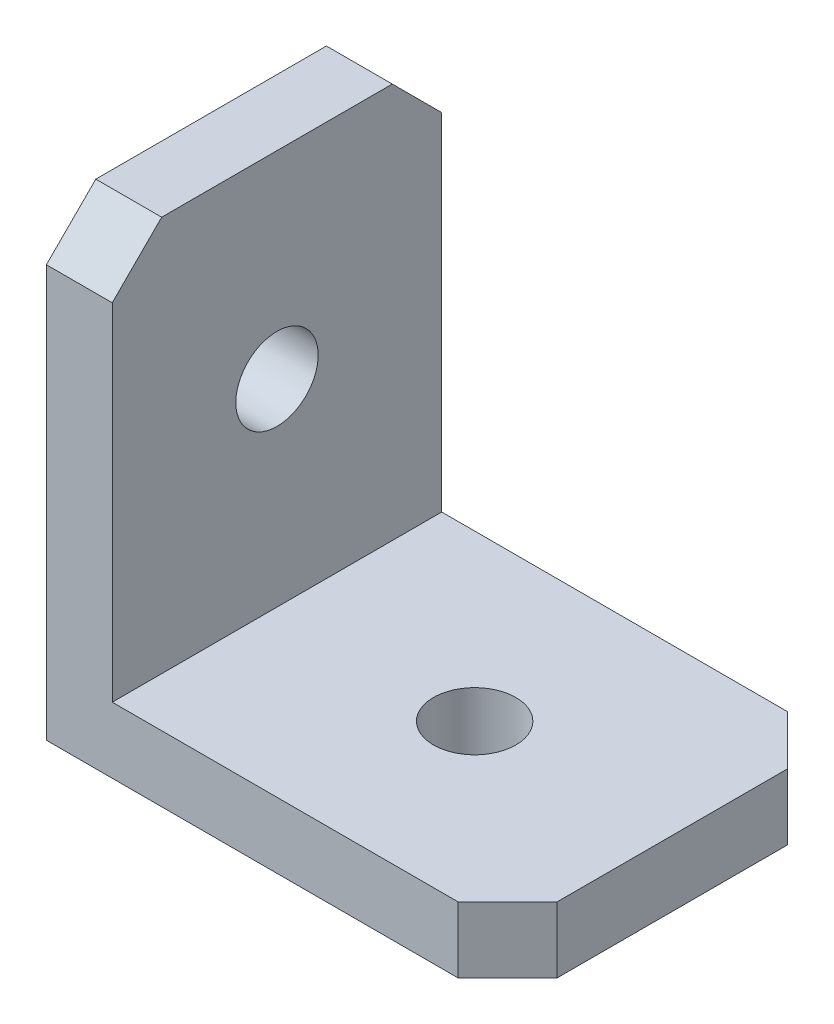
from build123d import *

# Parameters (mm, degrees)
BOSS_EXTRUDE1_DEPTH = 5
CHAMFER1_SIZE       = 1.5
SKETCH2_R           = 1.25
CUT_EXTRUDE1_DEPTH  = 21.420577857
SKETCH3_R           = 1.25
CUT_EXTRUDE2_DEPTH  = 10


with BuildPart() as part:
    # Sketch1 → Boss-Extrude1 (new, symmetric)
    with BuildSketch(Plane.XY):
        Polygon((0, 0), (0, 14), (2, 14), (2, 2), (14, 2), (14, 0), align=None)
    extrude(amount=BOSS_EXTRUDE1_DEPTH, both=True)

    # Chamfer1
    chamfer1_edges = [part.edges().sort_by_distance(p)[0] for p in [
        (14, 1, -5),
        (14, 1, 5),
        (1, 14, -5),
        (1, 14, 5),
    ]]
    chamfer(chamfer1_edges, length=CHAMFER1_SIZE)

    # Sketch2 → Cut-Extrude1 (cut, through all)
    with BuildSketch(Plane.ZY):
        with Locations((0, 8)):
            Circle(SKETCH2_R)
    extrude(amount=-CUT_EXTRUDE1_DEPTH, mode=Mode.SUBTRACT)

    # Sketch3 → Cut-Extrude2 (cut)
    with BuildSketch(Plane.XZ):
        with Locations((8, 0)):
            Circle(SKETCH3_R)
    extrude(amount=-CUT_EXTRUDE2_DEPTH, mode=Mode.SUBTRACT)


solid = part.part
